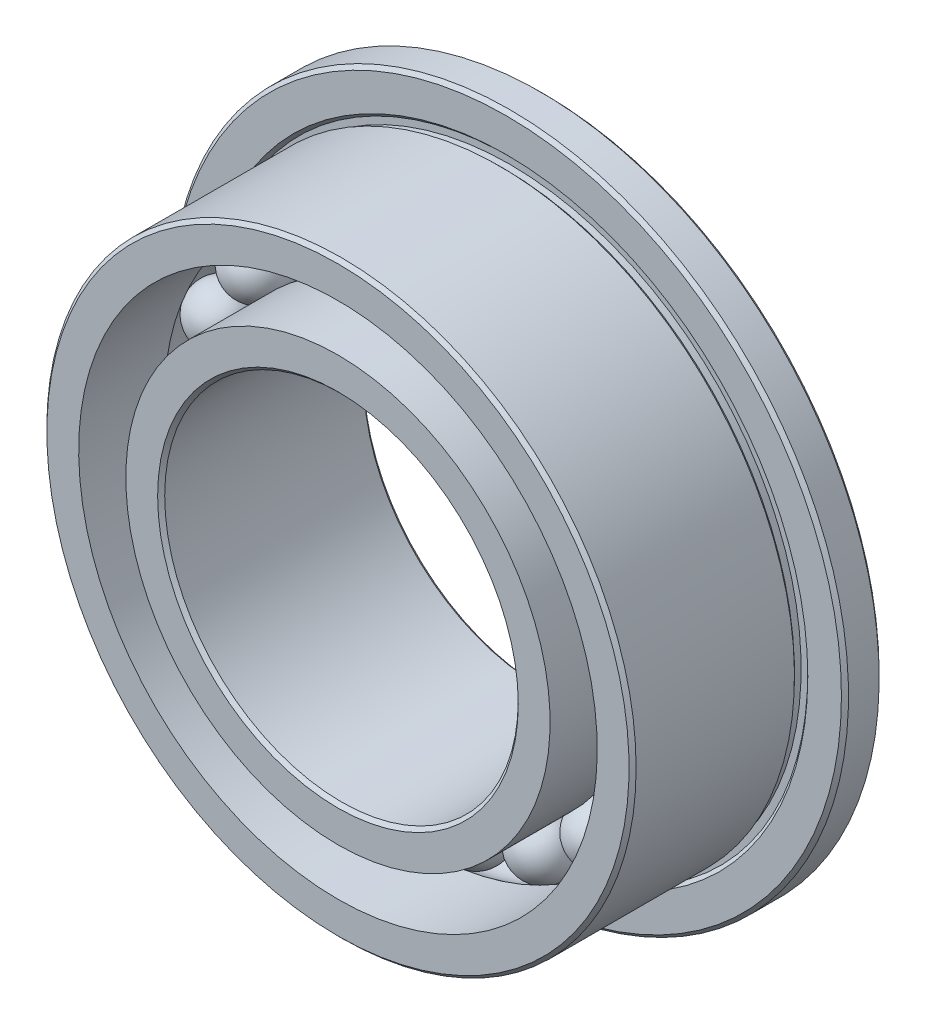
from build123d import *

# Parameters (mm, degrees)
FILLET1_SIZE      = 0.047625
FILLET2_SIZE      = 0.047625
CIRPATTERN3_COUNT = 21


with BuildPart() as part:
    # Sketch2 → Revolve1 (revolve)
    with BuildSketch(Plane(origin=(0, 0, 0), x_dir=(0, 0, -1), z_dir=(1, 0, 0))):
        with BuildLine():
            Line((1.3890625, 4.5593), (0.8810625, 4.5593))
            Line((0.8810625, 4.5593), (0.8810625, 4.058552561))
            Line((0.8810625, 4.058552561), (0.925963781, 4.013651281))
            Line((0.925963781, 4.013651281), (0.925963781, 3.923848719))
            Line((0.925963781, 3.923848719), (0.836161219, 3.923848719))
            Line((0.836161219, 3.923848719), (0.791259939, 3.96875))
            Line((0.791259939, 3.96875), (-1.3890625, 3.96875))
            Line((-1.3890625, 3.96875), (-1.3890625, 3.4925))
            Line((-1.3890625, 3.4925), (-0.238125, 3.4925))
            ThreePointArc((-0.238125, 3.4925), (0, 3.571875), (0.238125, 3.4925))
            Line((0.238125, 3.4925), (1.3890625, 3.4925))
            Line((1.3890625, 3.4925), (1.3890625, 4.5593))
        make_face()
        with BuildLine():
            Line((1.3890625, 2.38125), (-1.3890625, 2.38125))
            Line((-1.3890625, 2.38125), (-1.3890625, 2.8575))
            Line((-1.3890625, 2.8575), (-0.238125, 2.8575))
            ThreePointArc((-0.238125, 2.8575), (0, 2.778125), (0.238125, 2.8575))
            Line((0.238125, 2.8575), (1.3890625, 2.8575))
            Line((1.3890625, 2.8575), (1.3890625, 2.38125))
        make_face()
    revolve(axis=Axis((0, 0, 0), (0, 0, -1)))

    # Fillet1
    fillet1_edges = [part.edges().sort_by_distance(p)[0] for p in [
        (0, -4.5593, -1.3890625),
        (0, -4.5593, -0.8810625),
        (0, -3.96875, 1.3890625),
    ]]
    chamfer(fillet1_edges, length=FILLET1_SIZE)

    # Fillet2
    fillet2_edges = [part.edges().sort_by_distance(p)[0] for p in [
        (0, -2.38125, -1.3890625),
        (0, -2.38125, 1.3890625),
    ]]
    chamfer(fillet2_edges, length=FILLET2_SIZE)


with BuildPart() as body_2:
    # Sketch7 → Revolve3 (revolve)
    with BuildSketch(Plane.XY):
        with BuildLine():
            Line((0, 3.571875), (0, 2.778125))
            ThreePointArc((0, 2.778125), (-0.396875, 3.175), (0, 3.571875))
        make_face()
    revolve(axis=Axis((0, 3.571875, 0), (0, -1, 0)))


with BuildPart() as cirpattern3_1:
    # CirPattern3: pattern copy
    add(body_2.part.rotate(Axis((0, 0, 0), (0, 0, -1)), 1 * 360 / CIRPATTERN3_COUNT))


with BuildPart() as cirpattern3_2:
    # CirPattern3: pattern copy
    add(body_2.part.rotate(Axis((0, 0, 0), (0, 0, -1)), 2 * 360 / CIRPATTERN3_COUNT))


with BuildPart() as cirpattern3_3:
    # CirPattern3: pattern copy
    add(body_2.part.rotate(Axis((0, 0, 0), (0, 0, -1)), 3 * 360 / CIRPATTERN3_COUNT))


with BuildPart() as cirpattern3_4:
    # CirPattern3: pattern copy
    add(body_2.part.rotate(Axis((0, 0, 0), (0, 0, -1)), 4 * 360 / CIRPATTERN3_COUNT))


with BuildPart() as cirpattern3_5:
    # CirPattern3: pattern copy
    add(body_2.part.rotate(Axis((0, 0, 0), (0, 0, -1)), 5 * 360 / CIRPATTERN3_COUNT))


with BuildPart() as cirpattern3_6:
    # CirPattern3: pattern copy
    add(body_2.part.rotate(Axis((0, 0, 0), (0, 0, -1)), 6 * 360 / CIRPATTERN3_COUNT))


with BuildPart() as cirpattern3_7:
    # CirPattern3: pattern copy
    add(body_2.part.rotate(Axis((0, 0, 0), (0, 0, -1)), 7 * 360 / CIRPATTERN3_COUNT))


with BuildPart() as cirpattern3_8:
    # CirPattern3: pattern copy
    add(body_2.part.rotate(Axis((0, 0, 0), (0, 0, -1)), 8 * 360 / CIRPATTERN3_COUNT))


with BuildPart() as cirpattern3_9:
    # CirPattern3: pattern copy
    add(body_2.part.rotate(Axis((0, 0, 0), (0, 0, -1)), 9 * 360 / CIRPATTERN3_COUNT))


with BuildPart() as cirpattern3_10:
    # CirPattern3: pattern copy
    add(body_2.part.rotate(Axis((0, 0, 0), (0, 0, -1)), 10 * 360 / CIRPATTERN3_COUNT))


with BuildPart() as cirpattern3_11:
    # CirPattern3: pattern copy
    add(body_2.part.rotate(Axis((0, 0, 0), (0, 0, -1)), 11 * 360 / CIRPATTERN3_COUNT))


with BuildPart() as cirpattern3_12:
    # CirPattern3: pattern copy
    add(body_2.part.rotate(Axis((0, 0, 0), (0, 0, -1)), 12 * 360 / CIRPATTERN3_COUNT))


with BuildPart() as cirpattern3_13:
    # CirPattern3: pattern copy
    add(body_2.part.rotate(Axis((0, 0, 0), (0, 0, -1)), 13 * 360 / CIRPATTERN3_COUNT))


with BuildPart() as cirpattern3_14:
    # CirPattern3: pattern copy
    add(body_2.part.rotate(Axis((0, 0, 0), (0, 0, -1)), 14 * 360 / CIRPATTERN3_COUNT))


with BuildPart() as cirpattern3_15:
    # CirPattern3: pattern copy
    add(body_2.part.rotate(Axis((0, 0, 0), (0, 0, -1)), 15 * 360 / CIRPATTERN3_COUNT))


with BuildPart() as cirpattern3_16:
    # CirPattern3: pattern copy
    add(body_2.part.rotate(Axis((0, 0, 0), (0, 0, -1)), 16 * 360 / CIRPATTERN3_COUNT))


with BuildPart() as cirpattern3_17:
    # CirPattern3: pattern copy
    add(body_2.part.rotate(Axis((0, 0, 0), (0, 0, -1)), 17 * 360 / CIRPATTERN3_COUNT))


with BuildPart() as cirpattern3_18:
    # CirPattern3: pattern copy
    add(body_2.part.rotate(Axis((0, 0, 0), (0, 0, -1)), 18 * 360 / CIRPATTERN3_COUNT))


with BuildPart() as cirpattern3_19:
    # CirPattern3: pattern copy
    add(body_2.part.rotate(Axis((0, 0, 0), (0, 0, -1)), 19 * 360 / CIRPATTERN3_COUNT))


with BuildPart() as cirpattern3_20:
    # CirPattern3: pattern copy
    add(body_2.part.rotate(Axis((0, 0, 0), (0, 0, -1)), 20 * 360 / CIRPATTERN3_COUNT))


solid = Compound([part.part, body_2.part, cirpattern3_1.part, cirpattern3_2.part, cirpattern3_3.part, cirpattern3_4.part, cirpattern3_5.part, cirpattern3_6.part, cirpattern3_7.part, cirpattern3_8.part, cirpattern3_9.part, cirpattern3_10.part, cirpattern3_11.part, cirpattern3_12.part, cirpattern3_13.part, cirpattern3_14.part, cirpattern3_15.part, cirpattern3_16.part, cirpattern3_17.part, cirpattern3_18.part, cirpattern3_19.part, cirpattern3_20.part])
